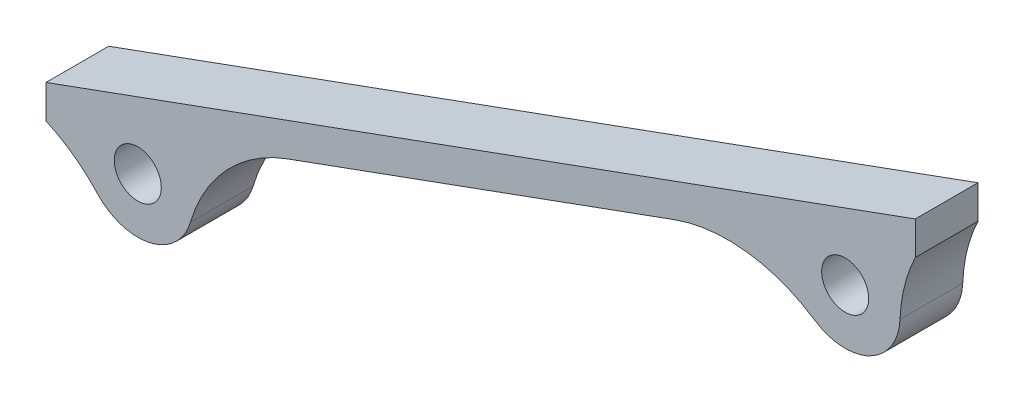
from build123d import *

# Parameters (mm, degrees)
BOSS_EXTRUDE1_DEPTH = 4
SKETCH2_R           = 1.5
BOSS_EXTRUDE2_DEPTH = 4
FILLET1_DEPTH       = 4


with BuildPart() as part:
    # Sketch1 → Boss-Extrude1 (new body)
    with BuildSketch(Plane.XY):
        Polygon((-70, -65.358547654), (-14.572335871, -45.184527756), (-14.572335871, -47.312883301), (-70, -67.486903199), align=None)
    extrude(amount=BOSS_EXTRUDE1_DEPTH)

    # Sketch2 → Boss-Extrude2 (add)
    # profile 1 of 6: a face of its own
    with BuildSketch(Plane(origin=(0, 0, 0), x_dir=(-1, 0, 0), z_dir=(0, 0, -1))):
        with BuildLine():
            ThreePointArc((15.753480329, -49.871140271), (17.845334, -54.357134945), (22.331328674, -52.265281274))
            ThreePointArc((22.331328674, -52.265281274), (22.489231637, -51.675979394), (22.542404501, -51.068210772))
            ThreePointArc((22.542404501, -51.068210772), (22.513056924, -50.615914674), (22.425506352, -50.171203601))
            Line((22.425506352, -50.171203601), (17.027383224, -48.206447461))
            ThreePointArc((17.027383224, -48.206447461), (16.262879385, -48.941184649), (15.753480329, -49.871140271))
        make_face()
        with Locations((19.042404501, -51.068210772)):
            Circle(SKETCH2_R, mode=Mode.SUBTRACT)
    # profile 2 of 6: a face of its own
    with BuildSketch(Plane(origin=(0, 0, 0), x_dir=(-1, 0, 0), z_dir=(0, 0, -1))):
        with BuildLine():
            Line((16.437520615, -47.991755029), (15.753480329, -49.871140271))
            ThreePointArc((15.753480329, -49.871140271), (16.262879385, -48.941184649), (17.027383224, -48.206447461))
            Line((17.027383224, -48.206447461), (16.437520615, -47.991755029))
        make_face()
    # profile 3 of 6: a face of its own
    with BuildSketch(Plane(origin=(0, 0, 0), x_dir=(-1, 0, 0), z_dir=(0, 0, -1))):
        with BuildLine():
            Line((22.331328674, -52.265281274), (23.015368961, -50.385896032))
            Line((23.015368961, -50.385896032), (22.425506352, -50.171203601))
            ThreePointArc((22.425506352, -50.171203601), (22.513056924, -50.615914674), (22.542404501, -51.068210772))
            ThreePointArc((22.542404501, -51.068210772), (22.489231637, -51.675979394), (22.331328674, -52.265281274))
        make_face()
    # profile 4 of 6: a face of its own
    with BuildSketch(Plane(origin=(0, 0, 0), x_dir=(-1, 0, 0), z_dir=(0, 0, -1))):
        with BuildLine():
            ThreePointArc((62.132629021, -64.62341434), (61.368125183, -65.358151529), (60.858726126, -66.28810715))
            ThreePointArc((60.858726126, -66.28810715), (62.950579797, -70.774101825), (67.436574472, -68.682248154))
            ThreePointArc((67.436574472, -68.682248154), (67.594477435, -68.092946274), (67.647650299, -67.485177652))
            ThreePointArc((67.647650299, -67.485177652), (67.618302722, -67.032881553), (67.53075215, -66.58817048))
            Line((67.53075215, -66.58817048), (62.132629021, -64.62341434))
        make_face()
        with Locations((64.147650299, -67.485177652)):
            Circle(SKETCH2_R, mode=Mode.SUBTRACT)
    # profile 5 of 6: a face of its own
    with BuildSketch(Plane(origin=(0, 0, 0), x_dir=(-1, 0, 0), z_dir=(0, 0, -1))):
        with BuildLine():
            Line((62.132629021, -64.62341434), (61.542766413, -64.408721909))
            Line((61.542766413, -64.408721909), (60.858726126, -66.28810715))
            ThreePointArc((60.858726126, -66.28810715), (61.368125183, -65.358151529), (62.132629021, -64.62341434))
        make_face()
    # profile 6 of 6: a face of its own
    with BuildSketch(Plane(origin=(0, 0, 0), x_dir=(-1, 0, 0), z_dir=(0, 0, -1))):
        with BuildLine():
            ThreePointArc((67.647650299, -67.485177652), (67.594477435, -68.092946274), (67.436574472, -68.682248154))
            Line((67.436574472, -68.682248154), (68.120614758, -66.802862912))
            Line((68.120614758, -66.802862912), (67.53075215, -66.58817048))
            ThreePointArc((67.53075215, -66.58817048), (67.618302722, -67.032881553), (67.647650299, -67.485177652))
        make_face()
    extrude(amount=-BOSS_EXTRUDE2_DEPTH)

    # Fillet1: read off the stored shape, not the designer's step
    # Fillet1 outline → Fillet1 (add)
    with BuildSketch(Plane.XY):
        with BuildLine():
            ThreePointArc((-15.753480329, -49.871140271), (-15.583589929, -50.532858787), (-15.545482945, -51.214974613))
            ThreePointArc((-15.545482945, -51.214974613), (-15.257091898, -49.214503996), (-14.572335871, -47.312883301))
            Line((-14.572335871, -47.312883301), (-16.437520615, -47.991755029))
            Line((-16.437520615, -47.991755029), (-15.753480329, -49.871140271))
        make_face()
        with BuildLine():
            Line((-23.015368961, -50.385896032), (-29.94492695, -52.908048877))
            ThreePointArc((-29.94492695, -52.908048877), (-25.335591086, -52.375928842), (-20.982265505, -53.981445964))
            ThreePointArc((-20.982265505, -53.981445964), (-21.794013834, -53.231228591), (-22.331328674, -52.265281274))
            Line((-22.331328674, -52.265281274), (-23.015368961, -50.385896032))
        make_face()
        with BuildLine():
            ThreePointArc((-60.858726126, -66.28810715), (-60.649434207, -67.373445046), (-60.78903907, -68.469926664))
            ThreePointArc((-60.78903907, -68.469926664), (-58.486204715, -64.44176545), (-54.613208423, -61.886569064))
            Line((-54.613208423, -61.886569064), (-61.542766413, -64.408721909))
            Line((-61.542766413, -64.408721909), (-60.858726126, -66.28810715))
        make_face()
        with BuildLine():
            ThreePointArc((-70, -67.486903199), (-68.243205646, -68.501846695), (-66.727429559, -69.850497708))
            ThreePointArc((-66.727429559, -69.850497708), (-67.139576393, -69.301321437), (-67.436574472, -68.682248154))
            Line((-67.436574472, -68.682248154), (-68.120614758, -66.802862912))
            Line((-68.120614758, -66.802862912), (-70, -67.486903199))
        make_face()
    extrude(amount=FILLET1_DEPTH)


solid = part.part
